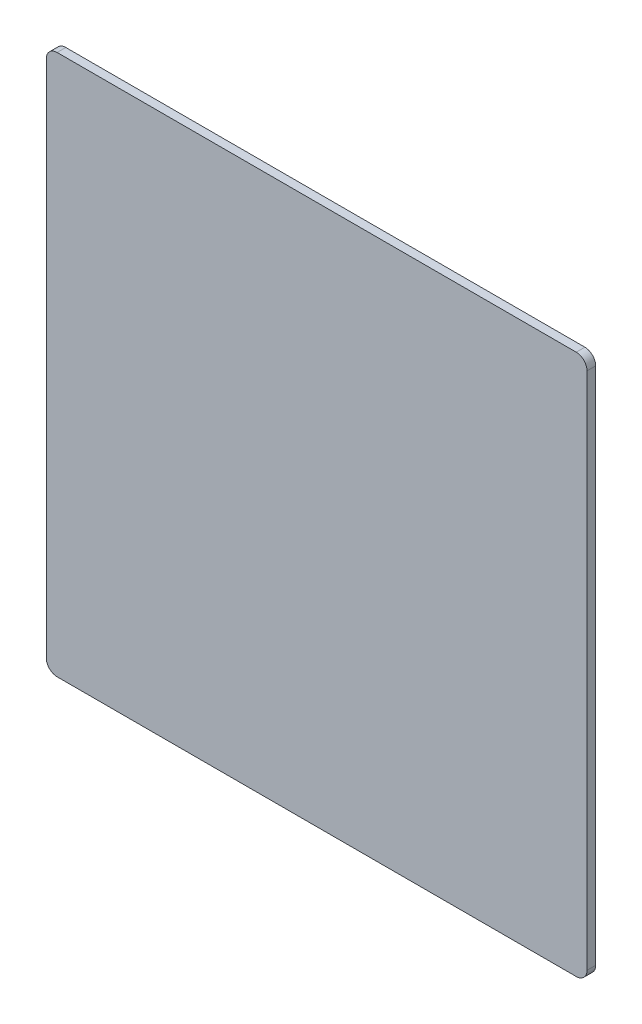
from build123d import *

# Parameters (mm, degrees)
EXTRUDE_1_DEPTH = 1.6


with BuildPart() as part:
    # 草图2 → 凸台-拉伸1 (new body)
    with BuildSketch(Plane.XY):
        with BuildLine():
            Line((-50, -48), (-50, 48))
            ThreePointArc((-50, 48), (-49.414213562, 49.414213562), (-48, 50))
            Line((-48, 50), (48, 50))
            ThreePointArc((48, 50), (49.414213562, 49.414213562), (50, 48))
            Line((50, 48), (50, -48))
            ThreePointArc((50, -48), (49.414213562, -49.414213562), (48, -50))
            Line((48, -50), (-48, -50))
            ThreePointArc((-48, -50), (-49.414213562, -49.414213562), (-50, -48))
        make_face()
    extrude(amount=EXTRUDE_1_DEPTH)


solid = part.part
